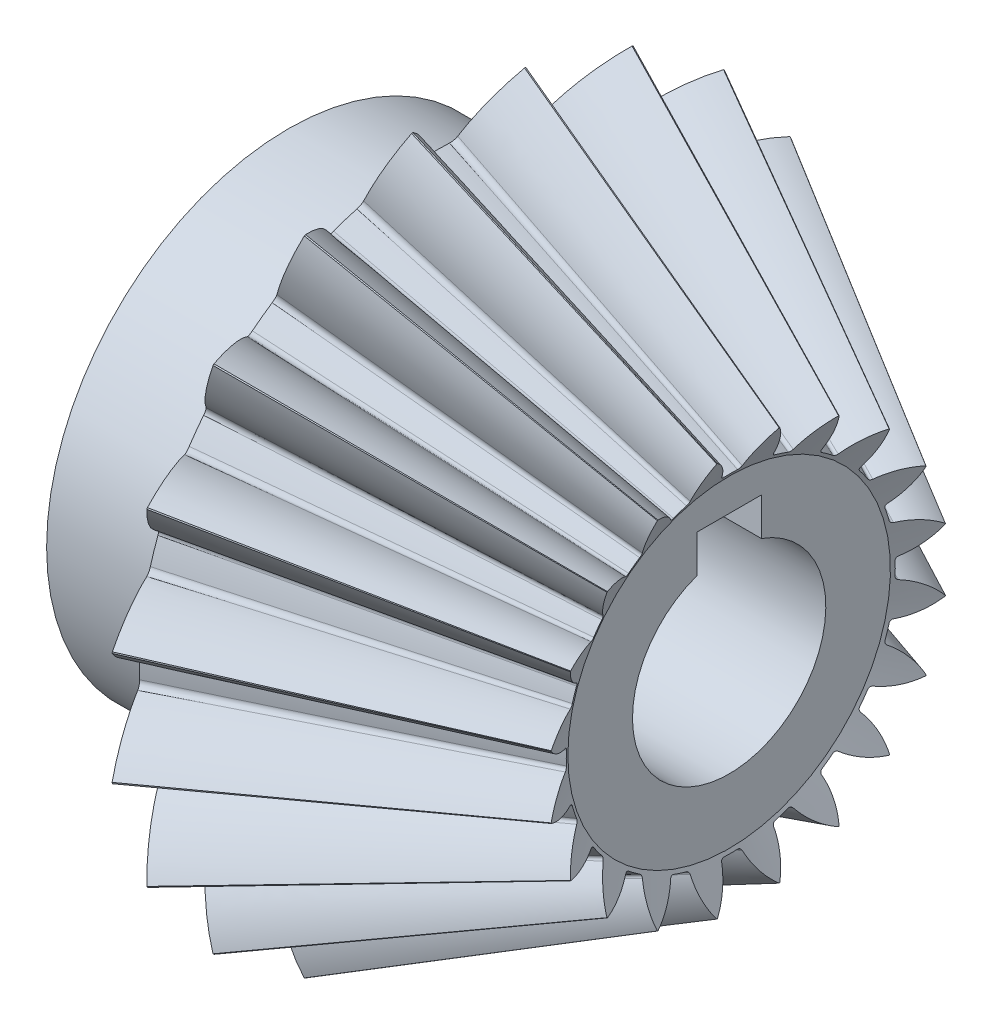
from build123d import *

# Parameters (mm, degrees)
TEETHCUTS_COUNT = 20
TEETHCUTS_ANGLE = 342
HUBSKE_R        = 7.5
HUB_DEPTH       = 4.528291257
BORSKE_R        = 3
BORE_DEPTH      = 25.0000508
KEYSKE_W        = 2
KEYSKE_H        = 4
KEYWAY_DEPTH    = 25.0000508


with BuildPart() as part:
    # BasProSke → Base-Revolve (revolve)
    with BuildSketch(Plane(origin=(0, 0, 0), x_dir=(1, 0, 0), z_dir=(0, 1, 0)), mode=Mode.PRIVATE) as base_revolve_sk:
        Polygon((0, 0), (0, 9.056379314), (1.07331263, 11.203004572), (9.748584537, 6.192868611), (9.155271908, 5.006243354), (9.155271908, 0), align=None)
    revolve(base_revolve_sk.sketch.rotate(Axis((-10, 0, 0), (1, 0, 0)), 180), axis=Axis((-10, 0, 0), (1, 0, 0)))

    # ToothCut: read off the stored shape, not the designer's step
    # ToothCut: loft between two sections, ruled curve by curve
    toothcut_from = [
        Edge.make_bspline([(20.475175686, 0.006730684, -0.010230454), (20.472620769, 0.00162085, -0.014432703), (20.469472441, -0.004675805, -0.01357417), (20.467444062, -0.008732563, -0.008122078)], [0, 0, 0, 0, 1, 1, 1, 1], 3, [1, 0.818595861, 0.818595861, 1]),
        Edge.make_bspline([(20.467444062, -0.008732563, 0.008122078), (20.469472441, -0.004675805, 0.01357417), (20.472620769, 0.00162085, 0.014432703), (20.475175686, 0.006730684, 0.010230454)], [0, 0, 0, 0, 1, 1, 1, 1], 3, [1, 0.818595861, 0.818595861, 1]),
        Edge.make_bspline([(20.467444062, -0.008732563, -0.008122078), (20.467124412, -0.009371863, -0.007262889), (20.466857955, -0.009904777, -0.006317325), (20.466649302, -0.010322084, -0.005301744)], [0, 0, 0, 0, 1, 1, 1, 1], 3, [1, 0.994233588, 0.994233588, 1]),
        Edge.make_bspline([(20.466649302, -0.010322084, 0.005301744), (20.466857955, -0.009904777, 0.006317325), (20.467124412, -0.009371863, 0.007262889), (20.467444062, -0.008732563, 0.008122078)], [0, 0, 0, 0, 1, 1, 1, 1], 3, [1, 0.994233588, 0.994233588, 1]),
        Edge.make_bspline([(20.466649302, -0.010322084, -0.005301744), (20.465946663, -0.011727361, -0.001881792), (20.465946663, -0.011727361, 0.001881792), (20.466649302, -0.010322084, 0.005301744)], [0, 0, 0, 0, 1, 1, 1, 1], 3, [1, 0.939130155, 0.939130155, 1]),
        Edge.make_line((20.475175686, 0.006730684, 0.010230454), (20.475175686, 0.006730684, -0.010230454)),
    ]
    toothcut_to = [
        Edge.make_bspline([(1.101068829, 11.258516969, -1.946212593), (0.857940224, 10.77225976, -1.2651625), (0.53110282, 10.118584953, -0.790532769), (0.153974829, 9.364328972, -0.570852964)], [0, 0, 0, 0, 1, 1, 1, 1], 3, [1, 0.965917598, 0.965917598, 1]),
        Edge.make_bspline([(0.153974829, 9.364328972, 0.570852964), (0.53110282, 10.118584953, 0.790532769), (0.857940224, 10.77225976, 1.2651625), (1.101068829, 11.258516969, 1.946212593)], [0, 0, 0, 0, 1, 1, 1, 1], 3, [1, 0.965917598, 0.965917598, 1]),
        Edge.make_bspline([(0.153974829, 9.364328972, -0.570852964), (0.113805435, 9.283990183, -0.547453999), (0.089108685, 9.234596684, -0.472849938), (0.090831971, 9.238043256, -0.380110711)], [0, 0, 0, 0, 1, 1, 1, 1], 3, [1, 0.852242502, 0.852242502, 1]),
        Edge.make_bspline([(0.090831971, 9.238043256, 0.380110711), (0.089108685, 9.234596684, 0.472849938), (0.113805435, 9.283990183, 0.547453999), (0.153974829, 9.364328972, 0.570852964)], [0, 0, 0, 0, 1, 1, 1, 1], 3, [1, 0.852242502, 0.852242502, 1]),
        Edge.make_bspline([(0.090831971, 9.238043256, -0.380110711), (0.095539445, 9.247458203, -0.126776434), (0.095539445, 9.247458203, 0.126776434), (0.090831971, 9.238043256, 0.380110711)], [0, 0, 0, 0, 1, 1, 1, 1], 3, [1, 0.999425256, 0.999425256, 1]),
        Edge.make_line((1.101068829, 11.258516969, 1.946212593), (1.101068829, 11.258516969, -1.946212593)),
    ]
    toothcut = Solid(Shell([*[Face.make_surface_from_curves(toothcut_from[k], toothcut_to[k]) for k in range(6)], Face(Wire(toothcut_from)), Face(Wire(toothcut_to))]))
    add(toothcut, mode=Mode.SUBTRACT)

    # TeethCuts: ToothCut ×20 about axis
    teethcuts_axis = Axis((-10, 0, 0), (1, 0, 0))
    for i in range(1, TEETHCUTS_COUNT):
        add(toothcut.rotate(teethcuts_axis, i * TEETHCUTS_ANGLE / (TEETHCUTS_COUNT - 1)), mode=Mode.SUBTRACT)

    # HubSke → Hub (add)
    with BuildSketch(Plane.ZY):
        with Locations(Location((0, 0, 0), (0, 0, 180))):
            Circle(HUBSKE_R)
    extrude(amount=HUB_DEPTH)

    # BorSke → Bore (cut, symmetric)
    with BuildSketch(Plane(origin=(0, 0, 0), x_dir=(0, 0, -1), z_dir=(1, 0, 0))):
        with Locations(Location((0, 0, 0), (0, 0, 180))):
            Circle(BORSKE_R)
    extrude(amount=BORE_DEPTH, both=True, mode=Mode.SUBTRACT)

    # KeySke → Keyway (cut, symmetric)
    with BuildSketch(Plane(origin=(0, 0, 0), x_dir=(0, 0, -1), z_dir=(1, 0, 0))):
        with Locations((0, 2)):
            Rectangle(KEYSKE_W, KEYSKE_H)
    extrude(amount=KEYWAY_DEPTH, both=True, mode=Mode.SUBTRACT)


solid = part.part
